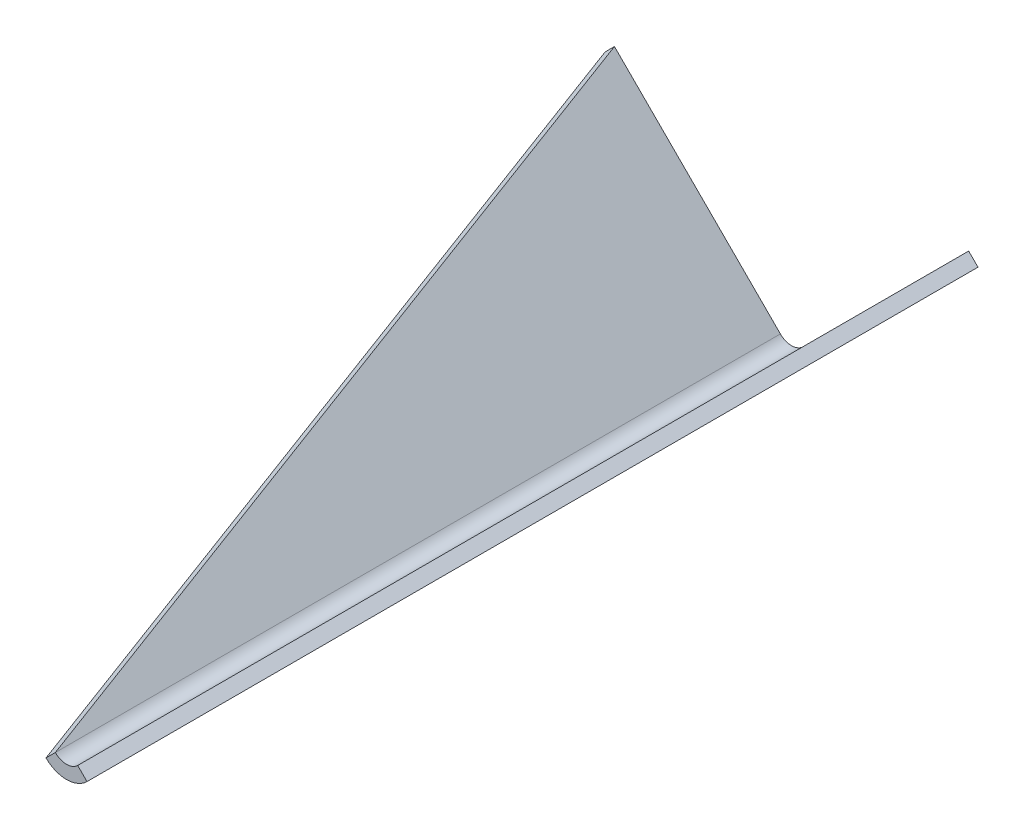
from build123d import *

# Parameters (mm, degrees)
BASE_FLANGE1_DEPTH = 55
CUT_EXTRUDE1_DEPTH = 10
CUT_EXTRUDE2_DEPTH = 10


# Read off the part's stored shape, not the designer's step: Base-Flange1
with BuildPart() as part:
    # Base-Flange1 outline → Base-Flange1 (new body)
    with BuildSketch(Plane.XY):
        with BuildLine():
            Line((-0.848528137, 2.2627417), (-13.435028843, 14.849242405))
            Line((-13.435028843, 14.849242405), (-14.142135624, 14.142135624))
            Line((-14.142135624, 14.142135624), (-1.555634919, 1.555634919))
            ThreePointArc((-1.555634919, 1.555634919), (0, 0.911269837), (1.555634919, 1.555634919))
            Line((1.555634919, 1.555634919), (14.142135624, 14.142135624))
            Line((14.142135624, 14.142135624), (13.435028843, 14.849242405))
            Line((13.435028843, 14.849242405), (0.848528137, 2.2627417))
            ThreePointArc((0.848528137, 2.2627417), (0, 1.911269837), (-0.848528137, 2.2627417))
        make_face()
    extrude(amount=BASE_FLANGE1_DEPTH)

    # Sketch6 → Cut-Extrude1 (cut)
    with BuildSketch(Plane(origin=(0, 0, 0), x_dir=(0, 0, 1), z_dir=(-0.7071067811865477, -0.7071067811865475, 0))):
        Polygon((0, 20), (55, 2.2), (55, 20), align=None)
    extrude(amount=-CUT_EXTRUDE1_DEPTH, mode=Mode.SUBTRACT)

    # Sketch7 → Cut-Extrude2 (cut)
    with BuildSketch(Plane(origin=(0, 0, 0), x_dir=(0, 0, -1), z_dir=(0.7071067811865488, -0.7071067811865462, 0))):
        Polygon((-55, 2.2), (0, 20), (-55, 20), align=None)
    extrude(amount=-CUT_EXTRUDE2_DEPTH, mode=Mode.SUBTRACT)


solid = part.part
